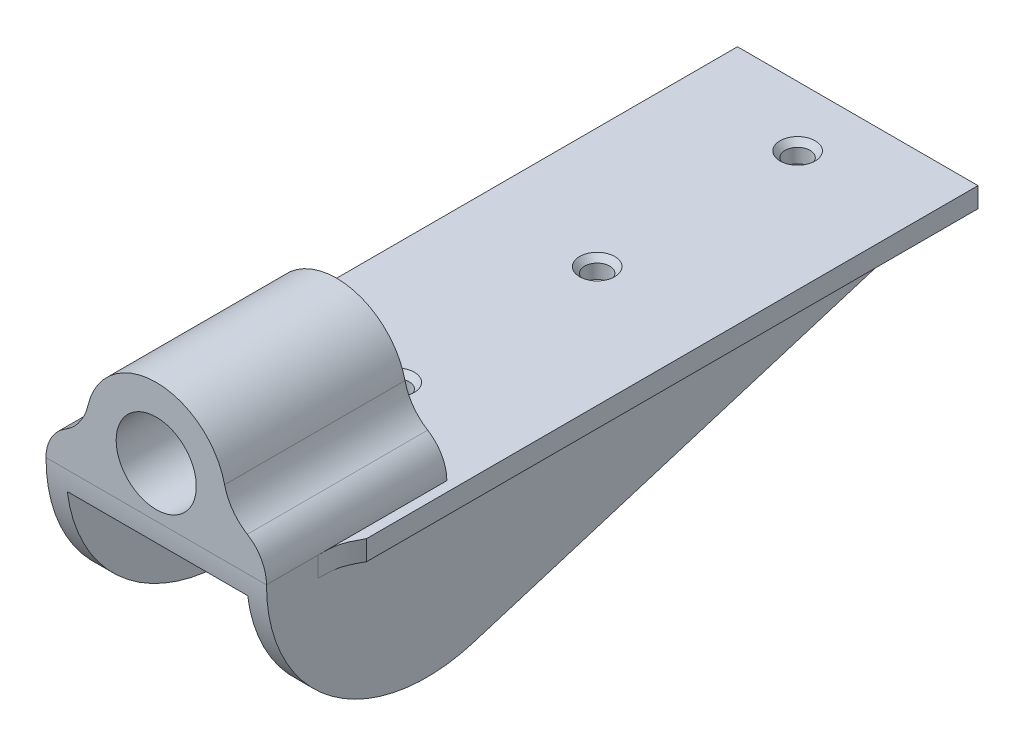
from build123d import *
from build123d.topology import SkipClean

# Parameters (mm, degrees)
BOSS_EXTRUDE1_DEPTH                             = 34.925
BOSS_EXTRUDE2_DEPTH                             = 38.1
CUT_EXTRUDE1_DEPTH                              = 28.575
FILLET1_START                                   = -6.35
FILLET1_DEPTH                                   = 6.35
BOSS_EXTRUDE3_START                             = -165.1
BOSS_EXTRUDE3_DEPTH                             = 57.15
SKETCH4_R                                       = 3.96875
CUT_EXTRUDE3_DEPTH                              = 232.143489097
CSK_FOR_12_FLAT_HEAD_MACHINE_SCREW1_D           = 5.7912
CSK_FOR_12_FLAT_HEAD_MACHINE_SCREW1_CSINK_D     = 11.1252
CSK_FOR_12_FLAT_HEAD_MACHINE_SCREW1_CSINK_ANGLE = 82


with BuildPart() as part:
    # Sketch2 → Boss-Extrude1 (new body)
    with BuildSketch(Plane(origin=(0, 0, 0), x_dir=(0, 0, -1), z_dir=(1, 0, 0))):
        with BuildLine():
            Line((28.575, -6.35), (0.398437524, -6.35))
            ThreePointArc((0.398437524, -6.35), (23.224782374, -42.664357172), (65.709887751, -48.562693987))
            Line((65.709887751, -48.562693987), (203.2, -6.35))
            Line((203.2, -6.35), (28.575, -6.35))
        make_face()
        Polygon((222.25, 0), (28.575, 0), (28.575, -6.35), (203.2, -6.35), (222.25, -6.35), align=None)
        with BuildLine():
            Line((28.575, 0), (0, 0))
            ThreePointArc((0, 0), (0.099707231, -3.181243957), (0.398437524, -6.35))
            Line((0.398437524, -6.35), (28.575, -6.35))
            Line((28.575, -6.35), (28.575, 0))
        make_face()
    boss_extrude1 = extrude(amount=BOSS_EXTRUDE1_DEPTH)

    # Sketch2<3> → Boss-Extrude2 (add)
    with BuildSketch(Plane(origin=(0, 0, 0), x_dir=(0, 0, -1), z_dir=(1, 0, 0))):
        Polygon((222.25, 0), (28.575, 0), (28.575, -6.35), (203.2, -6.35), (222.25, -6.35), align=None)
    boss_extrude2 = extrude(amount=BOSS_EXTRUDE2_DEPTH)

    # Sketch2<4> → Cut-Extrude1 (cut)
    with BuildSketch(Plane(origin=(0, 0, 0), x_dir=(0, 0, -1), z_dir=(1, 0, 0))):
        with BuildLine():
            Line((28.575, -6.35), (0.398437524, -6.35))
            ThreePointArc((0.398437524, -6.35), (23.224782374, -42.664357172), (65.709887751, -48.562693987))
            Line((65.709887751, -48.562693987), (203.2, -6.35))
            Line((203.2, -6.35), (28.575, -6.35))
        make_face()
    cut_extrude1 = extrude(amount=CUT_EXTRUDE1_DEPTH, mode=Mode.SUBTRACT)

    # Fillet1: read off the stored shape, not the designer's step
    # Fillet1 outline → Fillet1 (add)
    with BuildSketch(Plane(origin=(0, 0, 0), x_dir=(1, 0, 0), z_dir=(0, 1, 0)).offset(FILLET1_START)):
        with BuildLine():
            Line((34.925, 28.575), (34.925, 16.278277876))
            add(Edge.make_bspline(
                [(34.925, 16.278277876), (34.925, 22.836529675), (38.1, 28.575)],
                knots=[0, 0, 0, 1, 1, 1], degree=2, weights=[1, 1.936491673, 1]))
            Line((38.1, 28.575), (34.925, 28.575))
        make_face()
    fillet1 = extrude(amount=FILLET1_DEPTH)

    # Sketch3 → Boss-Extrude3 (add)
    with BuildSketch(Plane(origin=(0, 0, -222.25), x_dir=(-1, 0, 0), z_dir=(0, 0, -1)).offset(BOSS_EXTRUDE3_START)):
        with BuildLine():
            Line((0, 0), (0, 3.175))
            ThreePointArc((0, 3.175), (-12.7, 15.875), (0, 28.575))
            Line((0, 28.575), (0, 38.1))
            ThreePointArc((0, 38.1), (-13.852256532, 33.255034924), (-21.665035078, 20.832507443))
            ThreePointArc((-21.665035078, 20.832507443), (-24.250245873, 15.107068484), (-28.853915615, 10.832704084))
            ThreePointArc((-28.853915615, 10.832704084), (-33.303746055, 6.208976231), (-34.925, 0))
            Line((-34.925, 0), (0, 0))
        make_face()
    boss_extrude3 = extrude(amount=-BOSS_EXTRUDE3_DEPTH)

    # Mirror1: Boss-Extrude1, Boss-Extrude2, Cut-Extrude1, Fillet1, Boss-Extrude3 across plane
    with SkipClean():  # the faces are left unmerged after this step: merging them gives an invalid solid
        add(boss_extrude1.mirror(Plane(origin=(0, 28.575, 0), x_dir=(0, 0, 1), z_dir=(-1, 0, 0))))
        add(boss_extrude2.mirror(Plane(origin=(0, 28.575, 0), x_dir=(0, 0, 1), z_dir=(-1, 0, 0))))
        add(cut_extrude1.mirror(Plane(origin=(0, 28.575, 0), x_dir=(0, 0, 1), z_dir=(-1, 0, 0))), mode=Mode.SUBTRACT)
        add(fillet1.mirror(Plane(origin=(0, 28.575, 0), x_dir=(0, 0, 1), z_dir=(-1, 0, 0))))
        add(boss_extrude3.mirror(Plane(origin=(0, 28.575, 0), x_dir=(0, 0, 1), z_dir=(-1, 0, 0))))

    # Sketch4 → Cut-Extrude3 (cut, through all)
    with SkipClean():  # the faces are left unmerged after this step: merging them gives an invalid solid
        with BuildSketch(Plane(origin=(0, 0, 0), x_dir=(1, 0, 0), z_dir=(0, 1, 0))):
            with Locations(Location((0, 203.2, 0), (0, 0, 270))):
                Circle(SKETCH4_R)
            with Locations(Location((0, 139.7, 0), (0, 0, 270))):
                Circle(SKETCH4_R)
            with Locations(Location((0, 76.2, 0), (0, 0, 270))):
                Circle(SKETCH4_R)
        extrude(amount=-CUT_EXTRUDE3_DEPTH, mode=Mode.SUBTRACT)

    # CSK for #12 Flat Head Machine Screw1 (through all)
    with Locations(Plane(origin=(0, 0, 0), x_dir=(1, 0, 0), z_dir=(0, 1, 0))):
        with Locations((0, 76.2), (0, 139.7), (0, 203.2)):
            CounterSinkHole(CSK_FOR_12_FLAT_HEAD_MACHINE_SCREW1_D / 2, CSK_FOR_12_FLAT_HEAD_MACHINE_SCREW1_CSINK_D / 2, counter_sink_angle=CSK_FOR_12_FLAT_HEAD_MACHINE_SCREW1_CSINK_ANGLE)


solid = part.part
